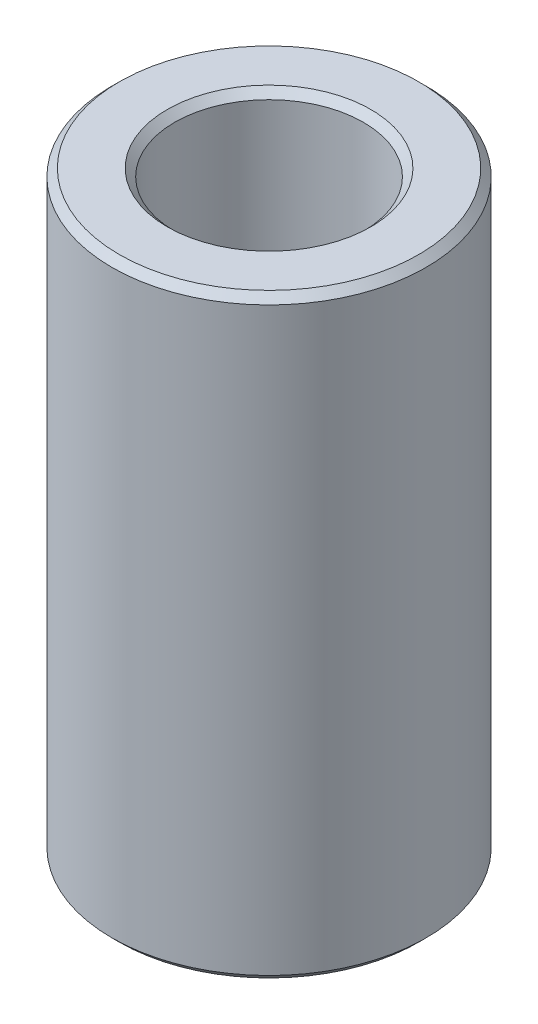
from build123d import *

# Parameters (mm, degrees)
SKETCH1_R           = 37.5
BOSS_EXTRUDE1_DEPTH = 142.139565345
SKETCH2_R           = 22.521533061
CUT_EXTRUDE1_DEPTH  = 152.710764406
CHAMFER1_SIZE       = 1.766896339


with BuildPart() as part:
    # Sketch1 → Boss-Extrude1 (new body)
    with BuildSketch(Plane(origin=(0, 0, 0), x_dir=(1, 0, 0), z_dir=(0, 1, 0))):
        Circle(SKETCH1_R)
    extrude(amount=BOSS_EXTRUDE1_DEPTH)

    # Sketch2 → Cut-Extrude1 (cut, through all)
    with BuildSketch(Plane(origin=(0, 0, 0), x_dir=(1, 0, 0), z_dir=(0, 1, 0))):
        Circle(SKETCH2_R)
    extrude(amount=CUT_EXTRUDE1_DEPTH, mode=Mode.SUBTRACT)

    # Chamfer1
    chamfer1_edges = [part.edges().sort_by_distance(p)[0] for p in [
        (-22.521533061, 142.139565345, 0),
        (-22.521533061, 0, 0),
        (-37.5, 0, 0),
        (-37.5, 142.139565345, 0),
    ]]
    chamfer(chamfer1_edges, length=CHAMFER1_SIZE)


solid = part.part
